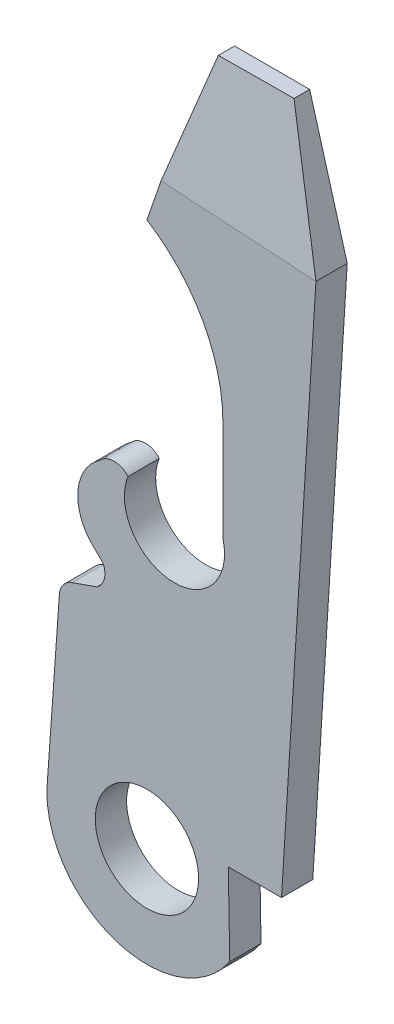
from build123d import *

# Parameters (mm, degrees)
BOSS_EXTRUDE1_DEPTH = 1.27
SKETCH2_R           = 2.0955
CUT_EXTRUDE1_DEPTH  = 67.522845197
CUT_EXTRUDE2_DEPTH  = 49.954473068


with BuildPart() as part:
    # Sketch1 → Boss-Extrude1 (new body)
    with BuildSketch(Plane.XY):
        with BuildLine():
            Line((48.63672497, 40.016070461), (47.23972497, 17.664070461))
            Line((47.23972497, 17.664070461), (45.08072497, 17.664070461))
            Line((45.08072497, 17.664070461), (45.138829135, 14.362070461))
            ThreePointArc((45.138829135, 14.362070461), (40.582766636, 12.764028795), (37.71472497, 16.648070461))
            Line((37.71472497, 16.648070461), (38.22272497, 23.760070461))
            ThreePointArc((38.22272497, 23.760070461), (38.362554576, 24.200011366), (38.73072497, 24.478490951))
            Line((38.73072497, 24.478490951), (39.74672497, 24.837701195))
            ThreePointArc((39.74672497, 24.837701195), (40.049261269, 25.268167832), (40.00072497, 25.792070461))
            Line((40.00072497, 25.792070461), (39.49272497, 26.300070461))
            ThreePointArc((39.49272497, 26.300070461), (38.988193496, 27.911636035), (39.876085241, 29.348070461))
            ThreePointArc((39.876085241, 29.348070461), (40.444046507, 29.602070461), (41.012007774, 29.348070461))
            ThreePointArc((41.012007774, 29.348070461), (42.761994924, 26.558475576), (44.863197729, 29.094070461))
            Line((44.863197729, 29.094070461), (44.863197729, 33.158070461))
            ThreePointArc((44.863197729, 33.158070461), (44.040883206, 36.349454025), (41.77872497, 38.746070461))
            Line((41.77872497, 38.746070461), (44.06472497, 45.366783193))
            Line((44.06472497, 45.366783193), (47.11272497, 45.366783193))
            Line((47.11272497, 45.366783193), (48.63672497, 40.016070461))
        make_face()
    extrude(amount=BOSS_EXTRUDE1_DEPTH)

    # Sketch2 → Cut-Extrude1 (cut, through all)
    with BuildSketch(Plane.XY.offset(1.27)):
        with Locations((41.77872497, 16.648070461)):
            Circle(SKETCH2_R)
    extrude(amount=-CUT_EXTRUDE1_DEPTH, mode=Mode.SUBTRACT)

    # Sketch3 → Cut-Extrude2 (cut, through all)
    with BuildSketch(Plane(origin=(45.956204144, -2.872262759, 0), x_dir=(0, 0, -1), z_dir=(0.9980525784828886, -0.06237828615518063, 0))):
        Polygon((-0.635, 48.217245983), (-1.27, 42.972017852), (-1.27, 48.217245983), align=None)
    extrude(amount=-CUT_EXTRUDE2_DEPTH, mode=Mode.SUBTRACT)


solid = part.part
